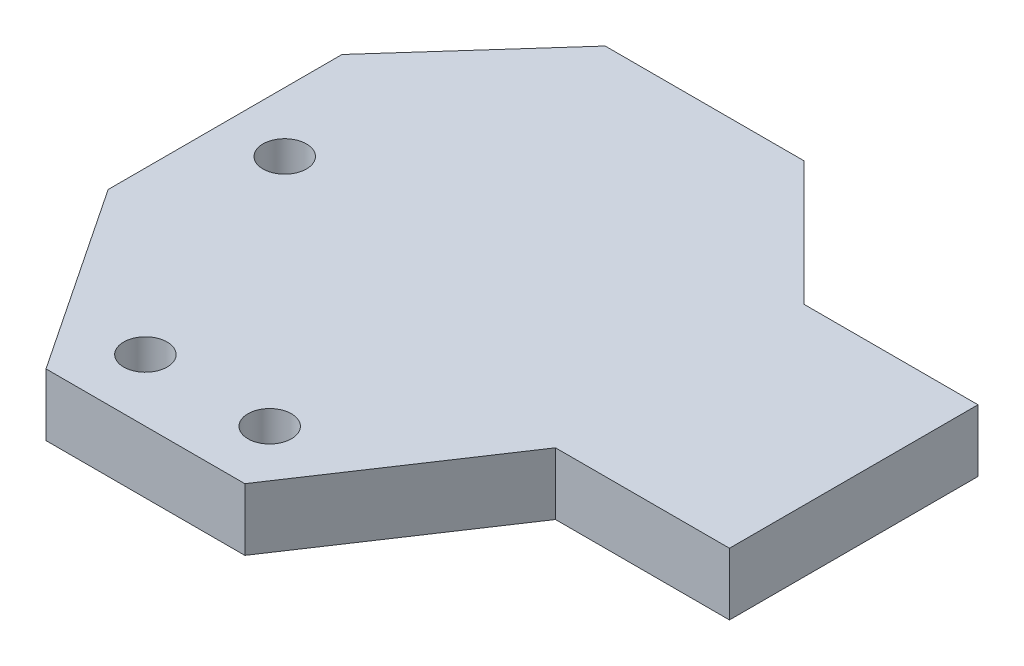
from build123d import *

# Parameters (mm, degrees)
SKETCH1_R           = 1.75
BOSS_EXTRUDE1_DEPTH = 5
SKETCH2_R           = 1.75
CUT_EXTRUDE1_DEPTH  = 10


with BuildPart() as part:
    # Sketch1 → Boss-Extrude1 (new body)
    with BuildSketch(Plane(origin=(0, 0, 0), x_dir=(1, 0, 0), z_dir=(0, 1, 0))):
        Polygon((10, 45), (0, 33.819660113), (0, 15), (10, 0), (26, 0), (36, 15), (50, 15), (50, 35), (36, 35), (26, 45), align=None)
        with Locations((13, 5)):
            Circle(SKETCH1_R, mode=Mode.SUBTRACT)
        with Locations((23, 5)):
            Circle(SKETCH1_R, mode=Mode.SUBTRACT)
    extrude(amount=BOSS_EXTRUDE1_DEPTH)

    # Sketch2 → Cut-Extrude1 (cut)
    with BuildSketch(Plane(origin=(0, 0, 0), x_dir=(-1, 0, 0), z_dir=(0, -1, 0))):
        with Locations((-4.8, 24.409830056)):
            Circle(SKETCH2_R)
    extrude(amount=-CUT_EXTRUDE1_DEPTH, mode=Mode.SUBTRACT)


solid = part.part
